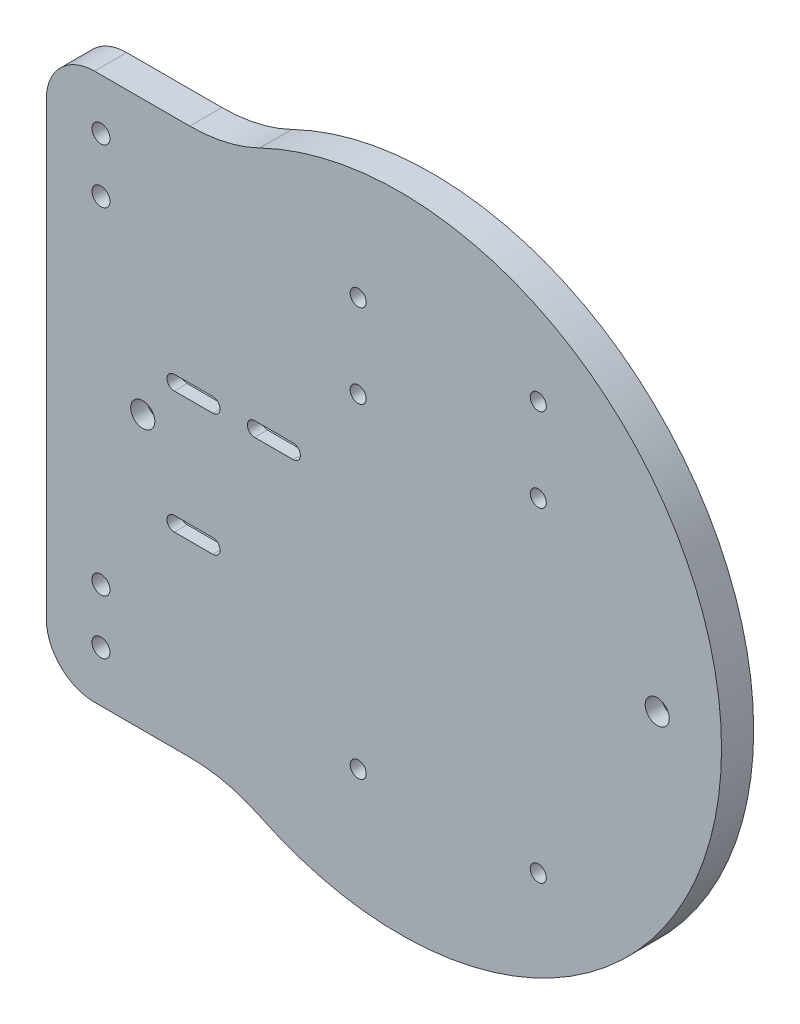
from build123d import *

# Parameters (mm, degrees)
SALIENTE_EXTRUIR2_DEPTH                              = 10
REDONDEO3_R                                          = 15
REDONDEO5_R                                          = 50
CROQUIS4_R                                           = 2.8
CROQUIS4_R_2                                         = 2.5
CORTAR_EXTRUIR1_DEPTH                                = 149.996644258
REFRENTADO_PARA_TORNILLO_CON_CABEZA_TRON_D           = 4.5
REFRENTADO_PARA_TORNILLO_CON_CABEZA_TRON_CBORE_D     = 7.5
REFRENTADO_PARA_TORNILLO_CON_CABEZA_TRON_CBORE_DEPTH = 5
CORTAR_EXTRUIR2_DEPTH                                = 6


with BuildPart() as part:
    # Croquis2 → Saliente-Extruir2 (new body)
    with BuildSketch(Plane(origin=(0, 0, 0), x_dir=(0, 1, 0), z_dir=(0, 0, 1))):
        with BuildLine():
            Line((-85, 52.678268764), (-85, 110))
            Line((-85, 110), (85, 110))
            Line((85, 110), (85, 52.678268764))
            ThreePointArc((85, 52.678268764), (0, -100), (-85, 52.678268764))
        make_face()
    extrude(amount=SALIENTE_EXTRUIR2_DEPTH)

    # Redondeo3
    redondeo3_edges = [part.edges().sort_by_distance(p)[0] for p in [
        (-110, 85, 5),
        (-110, -85, 5),
    ]]
    fillet(redondeo3_edges, radius=REDONDEO3_R)

    # Redondeo5
    redondeo5_edges = [part.edges().sort_by_distance(p)[0] for p in [
        (-52.678268764, 85, 5),
        (-52.678268764, -85, 5),
    ]]
    fillet(redondeo5_edges, radius=REDONDEO5_R)

    # Croquis4 → Cortar-Extruir1 (cut, through all)
    with BuildSketch(Plane.XY.offset(10)):
        with Locations((-93, 69.2)):
            Circle(CROQUIS4_R)
        with Locations((-93, 52.279001068)):
            Circle(CROQUIS4_R)
        with Locations((-93, -52.279001068)):
            Circle(CROQUIS4_R)
        with Locations((-93, -69.2)):
            Circle(CROQUIS4_R)
        with Locations((-13, 39)):
            Circle(CROQUIS4_R_2)
        with Locations((43, 39)):
            Circle(CROQUIS4_R_2)
        with Locations((-13, 65)):
            Circle(CROQUIS4_R_2)
        with Locations((43, 65)):
            Circle(CROQUIS4_R_2)
        with Locations((-13, -62)):
            Circle(CROQUIS4_R_2)
        with Locations((43, -62)):
            Circle(CROQUIS4_R_2)
        with BuildLine():
            Line((-58.219532094, 11.25), (-70.219532094, 11.25))
            ThreePointArc((-70.219532094, 11.25), (-72.469532094, 13.5), (-70.219532094, 15.75))
            Line((-70.219532094, 15.75), (-58.219532094, 15.75))
            ThreePointArc((-58.219532094, 15.75), (-55.969532094, 13.5), (-58.219532094, 11.25))
        make_face()
        with BuildLine():
            Line((-33.219532094, 11.25), (-45.219532094, 11.25))
            ThreePointArc((-45.219532094, 11.25), (-47.469532094, 13.5), (-45.219532094, 15.75))
            Line((-45.219532094, 15.75), (-33.219532094, 15.75))
            ThreePointArc((-33.219532094, 15.75), (-30.969532094, 13.5), (-33.219532094, 11.25))
        make_face()
        with BuildLine():
            Line((-58.219532094, -26.75), (-70.219532094, -26.75))
            ThreePointArc((-70.219532094, -26.75), (-72.469532094, -24.5), (-70.219532094, -22.25))
            Line((-70.219532094, -22.25), (-58.219532094, -22.25))
            ThreePointArc((-58.219532094, -22.25), (-55.969532094, -24.5), (-58.219532094, -26.75))
        make_face()
    extrude(amount=-CORTAR_EXTRUIR1_DEPTH, mode=Mode.SUBTRACT)

    # Refrentado para tornillo con cabeza troncocónica de M41 (through all)
    with Locations(Plane.XY.offset(10)):
        with Locations((-80, 0), (80, 0)):
            CounterBoreHole(REFRENTADO_PARA_TORNILLO_CON_CABEZA_TRON_D / 2, REFRENTADO_PARA_TORNILLO_CON_CABEZA_TRON_CBORE_D / 2, REFRENTADO_PARA_TORNILLO_CON_CABEZA_TRON_CBORE_DEPTH)

    # Croquis7 → Cortar-Extruir2 (cut)
    with BuildSketch(Plane(origin=(0, 0, 0), x_dir=(1, 0, 0), z_dir=(0, 0, -1))):
        with BuildLine():
            Line((-70.219532094, 29), (-58.219532094, 29))
            ThreePointArc((-58.219532094, 29), (-53.719532094, 24.5), (-58.219532094, 20))
            Line((-58.219532094, 20), (-70.219532094, 20))
            ThreePointArc((-70.219532094, 20), (-74.719532094, 24.5), (-70.219532094, 29))
        make_face()
        with BuildLine():
            Line((-70.219532094, -9), (-58.219532094, -9))
            ThreePointArc((-58.219532094, -9), (-53.719532094, -13.5), (-58.219532094, -18))
            Line((-58.219532094, -18), (-70.219532094, -18))
            ThreePointArc((-70.219532094, -18), (-74.719532094, -13.5), (-70.219532094, -9))
        make_face()
        with BuildLine():
            Line((-45.219532094, -9), (-33.219532094, -9))
            ThreePointArc((-33.219532094, -9), (-28.719532094, -13.5), (-33.219532094, -18))
            Line((-33.219532094, -18), (-45.219532094, -18))
            ThreePointArc((-45.219532094, -18), (-49.719532094, -13.5), (-45.219532094, -9))
        make_face()
    extrude(amount=-CORTAR_EXTRUIR2_DEPTH, mode=Mode.SUBTRACT)


solid = part.part
